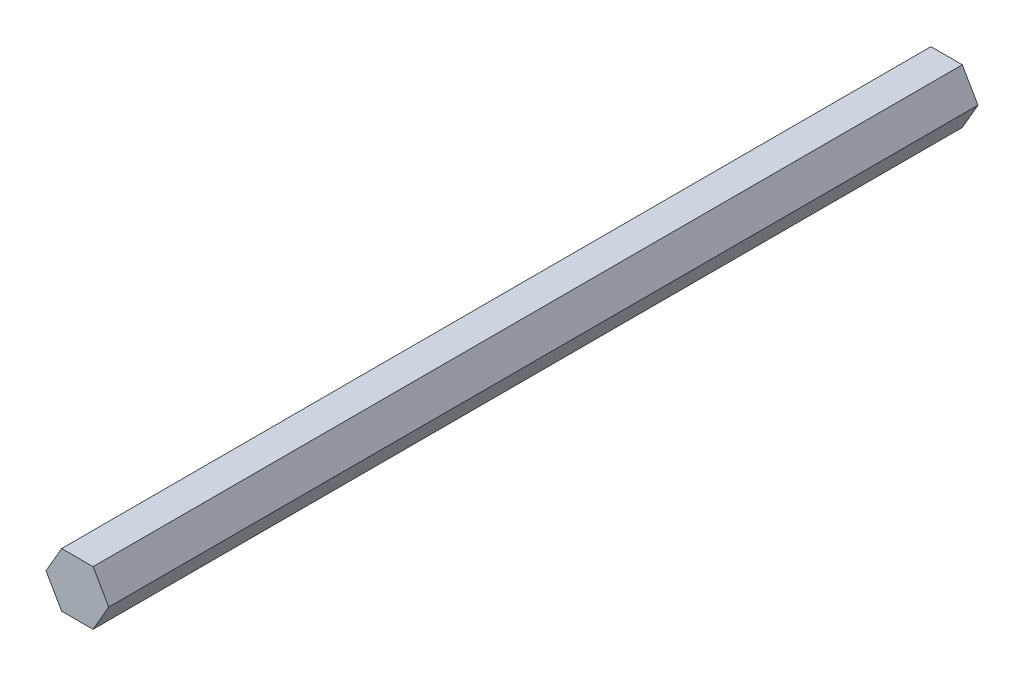
from build123d import *

# Parameters (mm, degrees)
BOSS_EXTRUDE1_DEPTH = 203.2


with BuildPart() as part:
    # Sketch1 → Boss-Extrude1 (new body)
    with BuildSketch(Plane.XY):
        Polygon((3.663549428, -6.351514695), (7.332347792, -0.003030475), (3.668798364, 6.34848422), (-3.663549428, 6.351514695), (-7.332347792, 0.003030475), (-3.668798364, -6.34848422), align=None)
    extrude(amount=BOSS_EXTRUDE1_DEPTH)


solid = part.part
